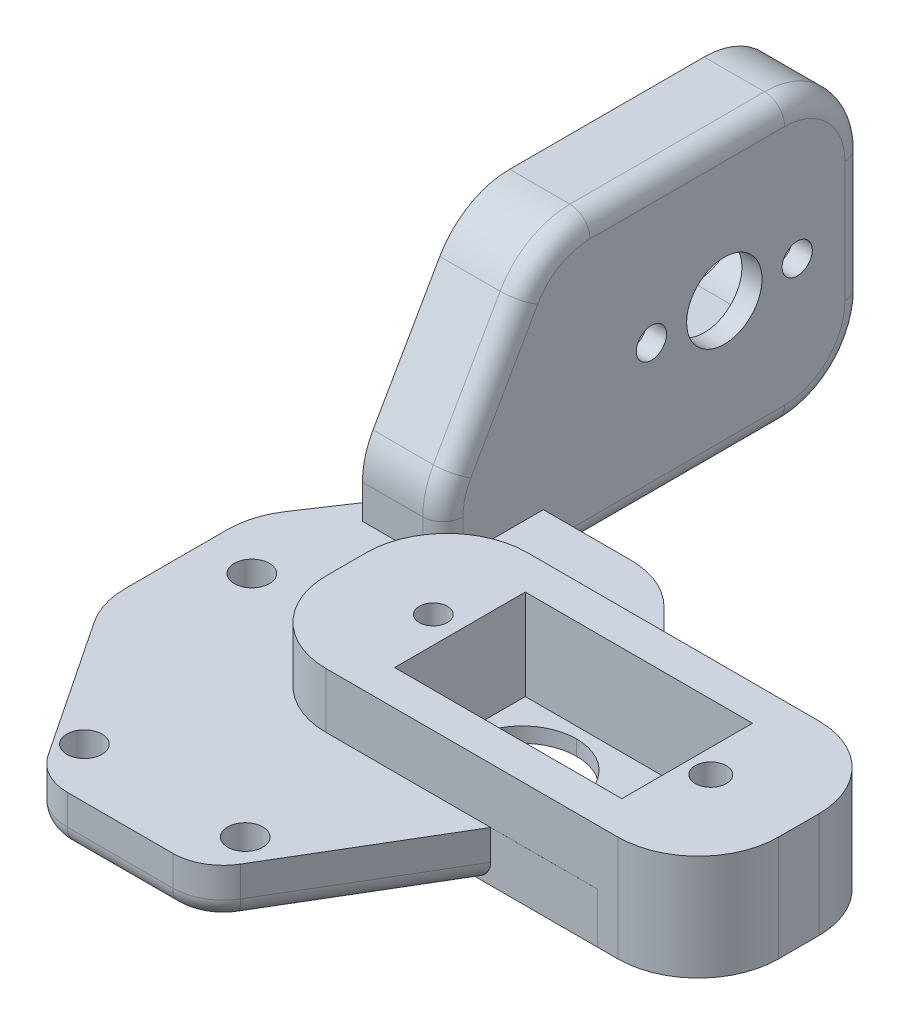
from build123d import *

# Parameters (mm, degrees)
BOSS_EXTRUDE1_DEPTH  = 5
SKETCH4_W            = 10.8
SKETCH4_H            = 10.8
SKETCH4_R            = 1.75
CUT_EXTRUDE1_DEPTH   = 129.260962426
FILLET1_R            = 5.4
FILLET2_R            = 5.4
FILLET3_R            = 10.000797
SKETCH5_W            = 35
SKETCH5_H            = 20
SKETCH5_W_2          = 23
SKETCH5_H_2          = 13
BOSS_EXTRUDE2_DEPTH  = 5.5
SKETCH6_W            = 23
SKETCH6_H            = 13
CUT_EXTRUDE2_DEPTH   = 3.5
CUT_EXTRUDE6_DEPTH   = 129.28142688
SKETCH8_W            = 8
SKETCH8_H            = 28
BOSS_EXTRUDE3_DEPTH  = 32
SKETCH9_R            = 2.5
SKETCH9_R_2          = 1.3
CUT_EXTRUDE7_DEPTH   = 69.854164991
FILLET4_R            = 8
BOSS_EXTRUDE9_DEPTH  = 8
SKETCH11_W           = 14
SKETCH11_H           = 7
CUT_EXTRUDE8_DEPTH   = 7
FILLET5_R            = 3.5
FILLET6_R            = 3.5
SKETCH12_W           = 5.3
SKETCH12_H           = 13
SKETCH12_R           = 1.4
BOSS_EXTRUDE11_DEPTH = 9
BOSS_EXTRUDE12_DEPTH = 10.5
SKETCH14_W           = 4.9
SKETCH14_H           = 13
CUT_EXTRUDE9_DEPTH   = 9
SKETCH15_R           = 1.546978048
CUT_EXTRUDE10_DEPTH  = 9
FILLET7_R            = 8
FILLET8_R            = 5
FILLET10_R           = 8
FILLET11_R           = 8
FILLET12_R           = 8
FILLET13_R           = 8
FILLET16_R           = 2
FILLET22_R           = 2
SKETCH17_W           = 21.644078019
SKETCH17_H           = 16.078457957
BOSS_EXTRUDE13_DEPTH = 8
SKETCH19_R           = 3.75
SKETCH19_R_2         = 1.5
CUT_EXTRUDE11_DEPTH  = 10
SKETCH20_W           = 20
SKETCH20_H           = 10
CUT_EXTRUDE12_DEPTH  = 6
FILLET23_R           = 5
FILLET24_R           = 5


# Some blends are built 0.0001 mm under size
with BuildPart() as part:
    # Sketch2 → Boss-Extrude1 (new body)
    with BuildSketch(Plane(origin=(0, 0, 0), x_dir=(1, 0, 0), z_dir=(0, 1, 0))):
        Polygon((125.06, 10), (125.06, -10), (103.812391816, -10.003388708), (93.080252563, -28.033388708), (77.080252563, -28.033388708), (65.060283257, -10.003388708), (65.060283257, 4.996611292), (75.061510114, 19.998489886), (91.061510114, 19.998489886), (101.06, 10), align=None)
    extrude(amount=BOSS_EXTRUDE1_DEPTH)

    # Sketch4 → Cut-Extrude1 (cut, through all)
    with BuildSketch(Plane(origin=(0, 5, 0), x_dir=(1, 0, 0), z_dir=(0, 1, 0))):
        with Locations((96.96, 0)):
            Rectangle(SKETCH4_W, SKETCH4_H)
        with Locations(Location((70.060283257, 0, 0), (0, 0, 270))):
            Circle(SKETCH4_R)
        with Locations(Location((76.436337536, -23.033388708, 0), (0, 0, 270))):
            Circle(SKETCH4_R)
        with Locations(Location((92.436337536, -23.033388708, 0), (0, 0, 270))):
            Circle(SKETCH4_R)
    extrude(amount=-CUT_EXTRUDE1_DEPTH, mode=Mode.SUBTRACT)

    # Fillet1
    fillet1_edges = [part.edges().sort_by_distance(p)[0] for p in [
        (91.56, 2.5, 5.4),
        (91.56, 2.5, -5.4),
    ]]
    fillet(fillet1_edges, radius=FILLET1_R - 0.0001)  # a hair under: the kernel refuses the full size

    # Fillet2
    # the kernel refuses this fillet: 5.4 mm, written as the material it adds along each edge
    with BuildSketch(Plane(origin=(102.36, 5, -5.4), x_dir=(0, 0, 1), z_dir=(0, -1, 0)), Plane(origin=(102.36, 5, 5.4), x_dir=(-1, 0, 0), z_dir=(0, -1, 0))) as fillet2_piece_1:
        with BuildLine():
            CenterArc((FILLET2_R, FILLET2_R), FILLET2_R, 180, 90)
            Line((0, FILLET2_R), (0, 0))
            Line((0, 0), (FILLET2_R, 0))
        make_face()
    extrude(amount=5)
    # the kernel refuses this fillet: 5.4 mm, written as the material it takes off along each edge

    # Fillet3
    fillet3_edges = [part.edges().sort_by_distance(p)[0] for p in [
        (125.06, 2.5, -10),
        (125.06, 2.5, 10),
    ]]
    fillet(fillet3_edges, radius=FILLET3_R)

    # Sketch5 → Boss-Extrude2 (add)
    with BuildSketch(Plane(origin=(0, 5, 0), x_dir=(1, 0, 0), z_dir=(0, 1, 0))):
        with Locations((96.96, 0)):
            Rectangle(SKETCH5_W, SKETCH5_H)
        with Locations((96.96, 0)):
            Rectangle(SKETCH5_W_2, SKETCH5_H_2, mode=Mode.SUBTRACT)
    extrude(amount=BOSS_EXTRUDE2_DEPTH)

    # Sketch6 → Cut-Extrude2 (cut)
    with BuildSketch(Plane(origin=(0, 5, 0), x_dir=(1, 0, 0), z_dir=(0, 1, 0))):
        with Locations((96.96, 0)):
            Rectangle(SKETCH6_W, SKETCH6_H)
    extrude(amount=-CUT_EXTRUDE2_DEPTH, mode=Mode.SUBTRACT)

    # Sketch7 → Cut-Extrude6 (cut, through all)
    with BuildSketch(Plane(origin=(0, 5, 0), x_dir=(1, 0, 0), z_dir=(0, 1, 0))):
        with BuildLine():
            Line((115.06079756, -10.001594738), (114.46, -10.001690558))
            Line((114.46, -10.001690558), (114.46, -12.384708422))
            Line((114.46, -12.384708422), (131.347766417, -12.384708422))
            Line((131.347766417, -12.384708422), (131.347766417, 10))
            Line((131.347766417, 10), (115.059202567, 10))
            ThreePointArc((115.059202567, 10), (125.059999968, 6.4e-08), (115.06079756, -10.001594738))
        make_face()
        with BuildLine():
            Line((114.46, 10), (114.46, -10))
            Line((114.46, -10), (114.46, -10.001690558))
            Line((114.46, -10.001690558), (115.06079756, -10.001594738))
            ThreePointArc((115.06079756, -10.001594738), (125.059999968, 6.4e-08), (115.059202567, 10))
            Line((115.059202567, 10), (114.46, 10))
        make_face()
    extrude(amount=-CUT_EXTRUDE6_DEPTH, mode=Mode.SUBTRACT)

    # Sketch8 → Boss-Extrude3 (add)
    with BuildSketch(Plane(origin=(0, 0, -19.998489886), x_dir=(-1, 0, 0), z_dir=(0, 0, -1))):
        with Locations((-75.061510114, 14)):
            Rectangle(SKETCH8_W, SKETCH8_H)
    extrude(amount=BOSS_EXTRUDE3_DEPTH)

    # Sketch9 → Cut-Extrude7 (cut, through all)
    with BuildSketch(Plane(origin=(79.061510114, 0, 0), x_dir=(0, 0, -1), z_dir=(1, 0, 0))):
        with Locations((37.998489886, 14)):
            Circle(SKETCH9_R)
        with Locations((33.498489886, 14)):
            Circle(SKETCH9_R_2)
        with Locations((42.498489886, 14)):
            Circle(SKETCH9_R_2)
    extrude(amount=-CUT_EXTRUDE7_DEPTH, mode=Mode.SUBTRACT)

    # Fillet4
    fillet4_edges = [part.edges().sort_by_distance(p)[0] for p in [
        (75.061510114, 0, -51.998489886),
        (75.061510114, 28, -51.998489886),
    ]]
    fillet(fillet4_edges, radius=FILLET4_R)

    # Sketch10 → Boss-Extrude9 (add)
    with BuildSketch(Plane.ZY.offset(-71.061510114)):
        Polygon((-19.998489886, 28), (-19.998489886, 0), (-10, 0), (-10, 10.5), align=None)
    extrude(amount=-BOSS_EXTRUDE9_DEPTH)

    # Sketch11 → Cut-Extrude8 (cut)
    with BuildSketch(Plane.ZY.offset(-71.061510114)):
        with Locations((-37.998489886, 14)):
            Rectangle(SKETCH11_W, SKETCH11_H)
    extrude(amount=-CUT_EXTRUDE8_DEPTH, mode=Mode.SUBTRACT)

    # Fillet5
    fillet5_edges = [part.edges().sort_by_distance(p)[0] for p in [
        (74.561510114, 10.5, -44.998489886),
        (74.561510114, 17.5, -44.998489886),
    ]]
    fillet(fillet5_edges, radius=FILLET5_R - 0.0001)  # a hair under: the kernel refuses the full size

    # Fillet6
    fillet6_edges = [part.edges().sort_by_distance(p)[0] for p in [
        (74.561510114, 17.5, -30.998489886),
        (74.561510114, 10.5, -30.998489886),
    ]]
    fillet(fillet6_edges, radius=FILLET6_R - 0.0001)  # a hair under: the kernel refuses the full size

    # Sketch12 → Boss-Extrude11 (add)
    with BuildSketch(Plane(origin=(0, 1.5, 0), x_dir=(1, 0, 0), z_dir=(0, 1, 0))):
        with Locations((88.11, 0)):
            Rectangle(SKETCH12_W, SKETCH12_H)
        with Locations(Location((88.11, 0, 0), (0, 0, 90))):
            Circle(SKETCH12_R, mode=Mode.SUBTRACT)
    extrude(amount=BOSS_EXTRUDE11_DEPTH)

    # Sketch13 → Boss-Extrude12 (add)
    with BuildSketch(Plane(origin=(0, 10.5, 0), x_dir=(1, 0, 0), z_dir=(0, 1, 0))):
        with BuildLine():
            Line((124.46, 10), (114.46, 10))
            Line((114.46, 10), (114.46, 0.911395129))
            ThreePointArc((114.46, 0.911395129), (116.189279939, 1.470860911), (117.256978048, 0))
            ThreePointArc((117.256978048, 0), (116.189279939, -1.470860911), (114.46, -0.911395129))
            Line((114.46, -0.911395129), (114.46, -10))
            Line((114.46, -10), (124.46, -10))
            Line((124.46, -10), (124.46, 10))
        make_face()
    extrude(amount=-BOSS_EXTRUDE12_DEPTH)

    # Sketch14 → Cut-Extrude9 (cut)
    with BuildSketch(Plane(origin=(0, 10.5, 0), x_dir=(1, 0, 0), z_dir=(0, 1, 0))):
        with Locations((110.91, 0)):
            Rectangle(SKETCH14_W, SKETCH14_H)
    extrude(amount=-CUT_EXTRUDE9_DEPTH, mode=Mode.SUBTRACT)

    # Sketch15 → Cut-Extrude10 (cut)
    with BuildSketch(Plane(origin=(0, 10.5, 0), x_dir=(1, 0, 0), z_dir=(0, 1, 0))):
        with Locations(Location((115.71, 0, 0), (0, 0, 270))):
            Circle(SKETCH15_R)
    extrude(amount=-CUT_EXTRUDE10_DEPTH, mode=Mode.SUBTRACT)

    # Fillet7
    fillet7_edges = [part.edges().sort_by_distance(p)[0] for p in [
        (124.46, 5.25, -10),
        (124.46, 5.25, 10),
    ]]
    fillet(fillet7_edges, radius=FILLET7_R)

    # Fillet8
    fillet8_edges = [part.edges().sort_by_distance(p)[0] for p in [
        (93.080252563, 2.5, 28.033388708),
        (77.080252563, 2.5, 28.033388708),
    ]]
    fillet(fillet8_edges, radius=FILLET8_R)

    # Fillet10
    fillet10_edges = [part.edges().sort_by_distance(p)[0] for p in [
        (65.060283257, 2.5, 10.003388708),
        (65.060283257, 2.5, -4.996611292),
    ]]
    fillet(fillet10_edges, radius=FILLET10_R)

    # Fillet11
    fillet11_edges = [part.edges().sort_by_distance(p)[0] for p in [
        (75.061510114, 28, -19.998489886),
        (75.061510114, 10.5, -10),
    ]]
    fillet(fillet11_edges, radius=FILLET11_R)

    # Fillet12
    fillet12_edges = [part.edges().sort_by_distance(p)[0] for p in [
        (79.46, 7.75, -10),
        (79.46, 7.75, 10),
    ]]
    fillet(fillet12_edges, radius=FILLET12_R)

    # Fillet13
    fillet13_edges = [part.edges().sort_by_distance(p)[0] for p in [
        (91.061510114, 2.5, -19.998489886),
    ]]
    fillet(fillet13_edges, radius=FILLET13_R)

    # Fillet16
    # the kernel refuses this fillet: 2 mm, written as the material it takes off along each edge
    with BuildSketch(Plane(origin=(66.403875672, 0, -7.012005062), x_dir=(0, 1, 0), z_dir=(0.5546992156114069, 0, -0.8320509480795573))) as fillet16_piece_1_section:
        with BuildLine():
            CenterArc((FILLET16_R, FILLET16_R), FILLET16_R, 180, 90)
            Line((0, FILLET16_R), (0, 0))
            Line((0, 0), (FILLET16_R, 0))
        make_face()
    fillet16_piece_1 = extrude(amount=13.396684746, mode=Mode.PRIVATE)
    fillet16_piece_1 = split(fillet16_piece_1, bisect_by=Plane(origin=(71.061510114, 0.474136614, -10.014110319), z_dir=(-1, 0, 0)), keep=Keep.TOP, mode=Mode.PRIVATE)
    add(fillet16_piece_1, mode=Mode.SUBTRACT)
    with BuildSketch(Plane(origin=(90.237704737, 0, 28.033388708), x_dir=(0, 1, 0), z_dir=(-1, 0, 0))) as fillet16_piece_2:
        with BuildLine():
            CenterArc((FILLET16_R, FILLET16_R), FILLET16_R, 180, 90)
            Line((0, FILLET16_R), (0, 0))
            Line((0, 0), (FILLET16_R, 0))
        make_face()
    extrude(amount=10.481529591, mode=Mode.SUBTRACT)
    with BuildSketch(Plane(origin=(106.369810481, 0, 5.706923908), x_dir=(0, 1, 0), z_dir=(-0.5114837329274393, 0, 0.8592929599098389))) as fillet16_piece_3_section:
        with BuildLine():
            CenterArc((FILLET16_R, FILLET16_R), FILLET16_R, 180, 90)
            Line((0, FILLET16_R), (0, 0))
            Line((0, 0), (FILLET16_R, 0))
        make_face()
    fillet16_piece_3 = extrude(amount=23.139818888, mode=Mode.PRIVATE)
    fillet16_piece_3 = split(fillet16_piece_3, bisect_by=Plane(origin=(98.720290848, 0.456449774, 10.00420083), z_dir=(0.00015948655604851523, 0, 0.9999999872820192)), keep=Keep.TOP, mode=Mode.PRIVATE)
    add(fillet16_piece_3, mode=Mode.SUBTRACT)
    with BuildSketch(Plane(origin=(90.237704737, 0, 23.033388708), x_dir=(0.8592929599098394, 0, 0.5114837329274385), z_dir=(0.5114837329274385, 0, -0.8592929599098394))) as fillet16_piece_4:
        with BuildLine():
            CenterArc((5 - FILLET16_R, -FILLET16_R), FILLET16_R, 0, 90)
            Line((5 - FILLET16_R, 0), (5, 0))
            Line((5, 0), (5, -FILLET16_R))
        make_face()
    revolve(axis=Axis((90.237704737, 0, 23.033388708), (0, -1, 0)), revolution_arc=59.237288923, mode=Mode.SUBTRACT)
    with BuildSketch(Plane(origin=(79.756175146, 0, 23.033388708), x_dir=(0, 0, 1), z_dir=(1, 0, 0))) as fillet16_piece_5:
        with BuildLine():
            CenterArc((5 - FILLET16_R, -FILLET16_R), FILLET16_R, 0, 90)
            Line((5 - FILLET16_R, 0), (5, 0))
            Line((5, 0), (5, -FILLET16_R))
        make_face()
    revolve(axis=Axis((79.756175146, 0, 23.033388708), (0, -1, 0)), revolution_arc=56.31, mode=Mode.SUBTRACT)
    with BuildSketch(Plane(origin=(75.595920406, 0, 25.806884786), x_dir=(0, 1, 0), z_dir=(-0.5546992156114031, 0, -0.8320509480795597))) as fillet16_piece_6:
        with BuildLine():
            CenterArc((FILLET16_R, FILLET16_R), FILLET16_R, 180, 90)
            Line((0, FILLET16_R), (0, 0))
            Line((0, 0), (FILLET16_R, 0))
        make_face()
    extrude(amount=16.571223602, mode=Mode.SUBTRACT)
    with BuildSketch(Plane(origin=(65.060283257, 0, 7.581188752), x_dir=(0, 1, 0), z_dir=(0, 0, -1))) as fillet16_piece_7:
        with BuildLine():
            CenterArc((FILLET16_R, FILLET16_R), FILLET16_R, 180, 90)
            Line((0, FILLET16_R), (0, 0))
            Line((0, 0), (FILLET16_R, 0))
        make_face()
    extrude(amount=10.155600089, mode=Mode.SUBTRACT)
    with BuildSketch(Plane(origin=(73.060283257, 0, -2.574411337), x_dir=(-1, 0, 0), z_dir=(0, 0, 1))) as fillet16_piece_8:
        with BuildLine():
            CenterArc((8 - FILLET16_R, -FILLET16_R), FILLET16_R, 0, 90)
            Line((8 - FILLET16_R, 0), (8, 0))
            Line((8, 0), (8, -FILLET16_R))
        make_face()
    revolve(axis=Axis((73.060283257, 0, -2.574411337), (0, -1, 0)), revolution_arc=33.69, mode=Mode.SUBTRACT)
    with BuildSketch(Plane(origin=(73.060283257, 0, 7.581188752), x_dir=(-0.83205094807956, 0, 0.5546992156114029), z_dir=(0.5546992156114029, 0, 0.83205094807956))) as fillet16_piece_9:
        with BuildLine():
            CenterArc((8 - FILLET16_R, -FILLET16_R), FILLET16_R, 0, 90)
            Line((8 - FILLET16_R, 0), (8, 0))
            Line((8, 0), (8, -FILLET16_R))
        make_face()
    revolve(axis=Axis((73.060283257, 0, 7.581188752), (0, -1, 0)), revolution_arc=33.69, mode=Mode.SUBTRACT)

    # Fillet22
    fillet22_edges = [part.edges().sort_by_distance(p)[0] for p in [
        (79.061510114, 14, -51.998489886),
        (79.061510114, 0, -31.998489886),
        (79.061510114, 28, -34.319953955),
        (79.061510114, 25.656854249, -49.655344135),
        (79.061510114, 2.343145751, -49.655344135),
        (79.061510114, 6.687881533, -10),
        (79.061510114, 18.156541174, -14.374505685),
        (79.061510114, 26.919150133, -20.625778419),
        (79.061510114, 10.42885505, -10.267936025),
    ]]
    fillet(fillet22_edges, radius=FILLET22_R)

    # Sketch17 → Boss-Extrude13 (add)
    with BuildSketch(Plane(origin=(79.061510114, 0, 0), x_dir=(0, 0, -1), z_dir=(1, 0, 0))):
        with Locations((36.586124991, 14.06004495)):
            Rectangle(SKETCH17_W, SKETCH17_H)
    extrude(amount=-BOSS_EXTRUDE13_DEPTH)

    # Sketch19 → Cut-Extrude11 (cut)
    with BuildSketch(Plane.ZY.offset(-71.061510114)):
        with Locations((-37.998489886, 14)):
            Circle(SKETCH19_R)
        with Locations((-30.748489886, 14)):
            Circle(SKETCH19_R_2)
        with Locations((-45.248489886, 14)):
            Circle(SKETCH19_R_2)
    extrude(amount=-CUT_EXTRUDE11_DEPTH, mode=Mode.SUBTRACT)

    # Sketch20 → Cut-Extrude12 (cut)
    with BuildSketch(Plane.ZY.offset(-71.061510114)):
        with Locations((-37.998489886, 14)):
            Rectangle(SKETCH20_W, SKETCH20_H)
    extrude(amount=-CUT_EXTRUDE12_DEPTH, mode=Mode.SUBTRACT)

    # Fillet23
    fillet23_edges = [part.edges().sort_by_distance(p)[0] for p in [
        (74.061510114, 19, -27.998489886),
        (74.061510114, 9, -27.998489886),
    ]]
    fillet(fillet23_edges, radius=FILLET23_R - 0.0001)  # a hair under: the kernel refuses the full size

    # Fillet24
    fillet24_edges = [part.edges().sort_by_distance(p)[0] for p in [
        (74.061510114, 9, -47.998489886),
        (74.061510114, 19, -47.998489886),
    ]]
    fillet(fillet24_edges, radius=FILLET24_R - 0.0001)  # a hair under: the kernel refuses the full size


solid = part.part
